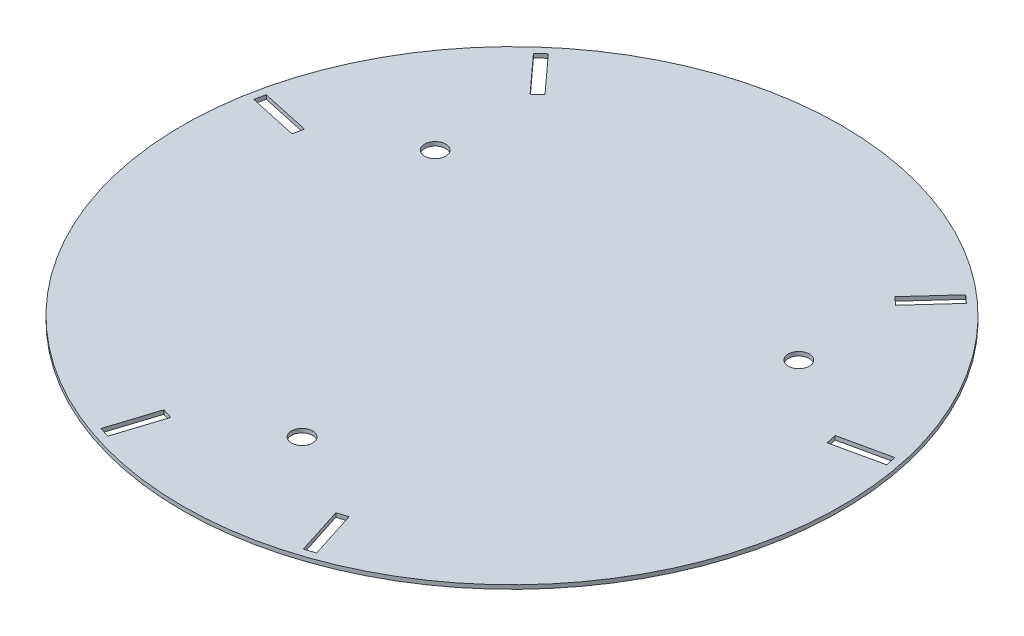
from build123d import *

# Parameters (mm, degrees)
SKETCH2_R           = 125
BOSS_EXTRUDE1_DEPTH = 1.5
SKETCH3_W           = 3
SKETCH3_H           = 19
CUT_EXTRUDE1_DEPTH  = 177.783059143
SKETCH4_R           = 4
CUT_EXTRUDE2_DEPTH  = 177.783059143


with BuildPart() as part:
    # Sketch2 → Boss-Extrude1 (new body)
    with BuildSketch(Plane(origin=(0, 0, 0), x_dir=(1, 0, 0), z_dir=(0, 1, 0))):
        Circle(SKETCH2_R)
    extrude(amount=BOSS_EXTRUDE1_DEPTH)

    # Sketch3 → Cut-Extrude1 (cut, through all)
    with BuildSketch(Plane(origin=(0, 1.5, 0), x_dir=(1, 0, 0), z_dir=(0, 1, 0))):
        with Locations((-268.691654721, -368.173324402)):
            Rectangle(SKETCH3_W, SKETCH3_H)
        Polygon((31.312, -98.125219266), (35.122688127, -96.909219266), (40.898688127, -115.009987868), (37.088, -116.225987868), align=None)
        Polygon((-37.088, -116.225987868), (-31.312, -98.125219266), (-35.122688127, -96.909219266), (-40.898688127, -115.009987868), align=None)
        Polygon((-82.110658074, 90.23214411), (-69.322932636, 76.179597076), (-66.364501682, 78.8717498), (-79.15222712, 92.924296834), align=None)
        Polygon((-100.634932636, 21.94562219), (-101.487189809, 18.037469466), (-120.050915246, 22.085691035), (-119.198658074, 25.993843759), align=None)
        Polygon((119.198658074, 25.993843759), (100.634932636, 21.94562219), (101.487189809, 18.037469466), (120.050915246, 22.085691035), align=None)
        Polygon((69.322932636, 76.179597076), (66.364501682, 78.8717498), (79.15222712, 92.924296834), (82.110658074, 90.23214411), align=None)
    extrude(amount=-CUT_EXTRUDE1_DEPTH, mode=Mode.SUBTRACT)

    # Sketch4 → Cut-Extrude2 (cut, through all)
    with BuildSketch(Plane(origin=(0, 1.5, 0), x_dir=(1, 0, 0), z_dir=(0, 1, 0))):
        with Locations((0, -79.639104061)):
            Circle(SKETCH4_R)
        with Locations((-68.969487251, 39.81955203)):
            Circle(SKETCH4_R)
        with Locations((68.969487251, 39.81955203)):
            Circle(SKETCH4_R)
    extrude(amount=-CUT_EXTRUDE2_DEPTH, mode=Mode.SUBTRACT)


solid = part.part
